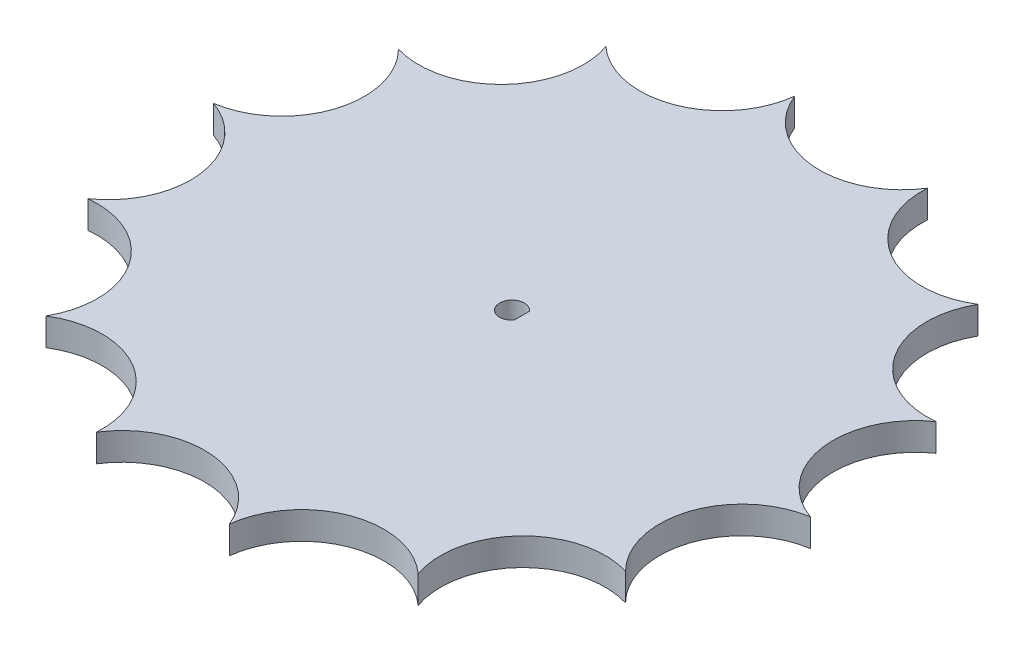
from build123d import *

# Parameters (mm, degrees)
SKETCH1_R           = 8.255
BOSS_EXTRUDE1_DEPTH = 4.572
BOSS_EXTRUDE2_DEPTH = 6.35


with BuildPart() as part:
    # Sketch1 → Boss-Extrude1 (new body)
    with BuildSketch(Plane(origin=(0, 0, 0), x_dir=(1, 0, 0), z_dir=(0, 1, 0))):
        Circle(SKETCH1_R)
        with BuildLine():
            Line((2.236967199, -1.778), (2.236967199, 1.778))
            ThreePointArc((2.236967199, 1.778), (-2.8575, 0), (2.236967199, -1.778))
        make_face(mode=Mode.SUBTRACT)
    extrude(amount=BOSS_EXTRUDE1_DEPTH)

    # Sketch2 → Boss-Extrude2 (add)
    with BuildSketch(Plane(origin=(0, 4.572, 0), x_dir=(1, 0, 0), z_dir=(0, 1, 0))):
        with BuildLine():
            ThreePointArc((-10.169246297, 75.518384714), (-22.413710496, 59.86404587), (-41.928373455, 63.627442974))
            ThreePointArc((-41.928373455, 63.627442974), (-46.168091432, 44.210697118), (-65.383072033, 39.134305814))
            ThreePointArc((-65.383072033, 39.134305814), (-60.778315646, 19.800877593), (-75.887851324, 6.890139437))
            ThreePointArc((-75.887851324, 6.890139437), (-63.350649048, -8.530748581), (-71.362110957, -26.718703558))
            ThreePointArc((-71.362110957, -26.718703558), (-53.375609462, -35.172755376), (-52.702229316, -55.03557963))
            ThreePointArc((-52.702229316, -55.03557963), (-32.828875813, -54.848366603), (-23.604024808, -72.451984189))
            ThreePointArc((-23.604024808, -72.451984189), (-5.779980689, -63.660586154), (10.169246297, -75.518384714))
            ThreePointArc((10.169246297, -75.518384714), (22.413710496, -59.86404587), (41.928373455, -63.627442974))
            ThreePointArc((41.928373455, -63.627442974), (46.168091432, -44.210697118), (65.383072033, -39.134305814))
            ThreePointArc((65.383072033, -39.134305814), (60.778315646, -19.800877593), (75.887851324, -6.890139437))
            ThreePointArc((75.887851324, -6.890139437), (63.350649048, 8.530748581), (71.362110957, 26.718703558))
            ThreePointArc((71.362110957, 26.718703558), (53.375609462, 35.172755376), (52.702229316, 55.03557963))
            ThreePointArc((52.702229316, 55.03557963), (32.828875813, 54.848366603), (23.604024808, 72.451984189))
            ThreePointArc((23.604024808, 72.451984189), (5.779980689, 63.660586154), (-10.169246297, 75.518384714))
        make_face()
        with BuildLine():
            Line((2.236967199, 1.778), (2.236967199, -1.778))
            ThreePointArc((2.236967199, -1.778), (-2.8575, 0), (2.236967199, 1.778))
        make_face(mode=Mode.SUBTRACT)
    extrude(amount=BOSS_EXTRUDE2_DEPTH)


solid = part.part
